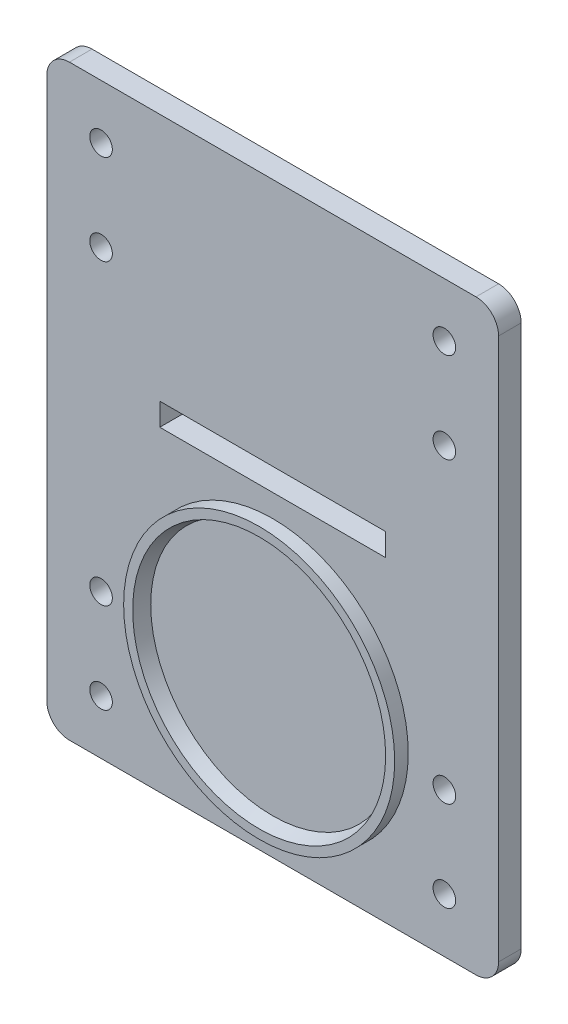
from build123d import *

# Parameters (mm, degrees)
SKIZZE1_W                       = 100
SKIZZE1_H                       = 130
AUFSATZ_LINEAR_AUSTRAGEN1_DEPTH = 5
SKIZZE2_R                       = 30
SKIZZE2_R_2                     = 27
AUFSATZ_LINEAR_AUSTRAGEN2_DEPTH = 3
SKIZZE4_R                       = 2.5
SKIZZE4_W                       = 50
SKIZZE4_H                       = 5
SCHNITT_LINEAR_AUSTRAGEN1_DEPTH = 83.158383626
FASE1_SIZE2                     = 3
FASE1_SIZE                      = 1
VERRUNDUNG1_R                   = 5


with BuildPart() as part:
    # Skizze1 → Aufsatz-Linear austragen1 (new body)
    with BuildSketch(Plane.XY):
        Rectangle(SKIZZE1_W, SKIZZE1_H)
    extrude(amount=AUFSATZ_LINEAR_AUSTRAGEN1_DEPTH)

    # Skizze2 → Aufsatz-Linear austragen2 (add)
    with BuildSketch(Plane.XY.offset(5)):
        with Locations(Location((0, -30, 0), (0, 0, 180))):
            Circle(SKIZZE2_R)
        with Locations((0, -30)):
            Circle(SKIZZE2_R_2, mode=Mode.SUBTRACT)
    extrude(amount=AUFSATZ_LINEAR_AUSTRAGEN2_DEPTH)

    # Skizze4 → Schnitt-Linear austragen1 (cut, through all)
    with BuildSketch(Plane.XY.offset(5)):
        with Locations((-38, -53)):
            Circle(SKIZZE4_R)
        with Locations((38, -53)):
            Circle(SKIZZE4_R)
        with Locations((38, 53)):
            Circle(SKIZZE4_R)
        with Locations((-38, 53)):
            Circle(SKIZZE4_R)
        with Locations((-38, -33)):
            Circle(SKIZZE4_R)
        with Locations((38, -33)):
            Circle(SKIZZE4_R)
        with Locations((38, 33)):
            Circle(SKIZZE4_R)
        with Locations((-38, 33)):
            Circle(SKIZZE4_R)
        with Locations((0, 7.5)):
            Rectangle(SKIZZE4_W, SKIZZE4_H)
    extrude(amount=-SCHNITT_LINEAR_AUSTRAGEN1_DEPTH, mode=Mode.SUBTRACT)

    # Fase1
    fase1_edges = [part.edges().sort_by_distance(p)[0] for p in [
        (-27, -30, 8),
    ]]
    fase1_side = [part.faces().sort_by_distance(p)[0] for p in [
        (-27.02, -30, 8),
    ]]
    chamfer(fase1_edges, length=FASE1_SIZE - 0.0001, length2=FASE1_SIZE2 - 0.0001, reference=fase1_side[0])  # a hair under: the kernel refuses the full size

    # Verrundung1
    verrundung1_edges = [part.edges().sort_by_distance(p)[0] for p in [
        (50, -65, 2.5),
        (-50, -65, 2.5),
        (-50, 65, 2.5),
        (50, 65, 2.5),
    ]]
    fillet(verrundung1_edges, radius=VERRUNDUNG1_R)


solid = part.part
